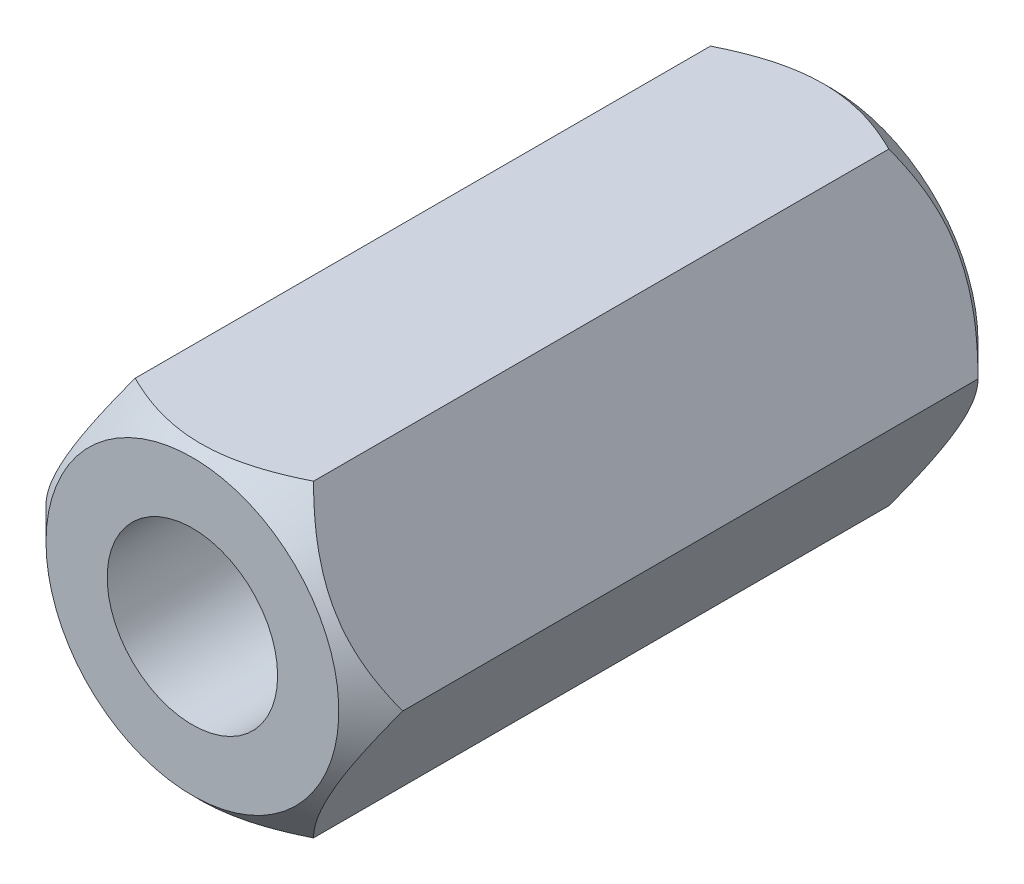
from build123d import *

# Parameters (mm, degrees)
EXTRUDE_1_DEPTH   = 3
HOLE_WIZARD_M21_D = 1.6


with BuildPart() as part:
    # Эскиз1 → Бобышка-Вытянуть1 (new, symmetric)
    with BuildSketch(Plane.XY):
        Polygon((1.674315781, 0), (0.83715789, 1.45), (-0.83715789, 1.45), (-1.674315781, 0), (-0.83715789, -1.45), (0.83715789, -1.45), align=None)
    extrude(amount=EXTRUDE_1_DEPTH, both=True)

    # Отверстие обработанное метчиком M21 (through all)
    with Locations(Plane.XY.offset(3)):
        with Locations((0, 0)):
            Hole(HOLE_WIZARD_M21_D / 2)

    # Эскиз4 → Вырез-Повернуть1 (revolve, cut)
    with BuildSketch(Plane(origin=(0, 0, 0), x_dir=(0, 0, -1), z_dir=(0, 1, 0))):
        Polygon((3, 1.374315781), (2.7, 1.674315781), (3, 1.674315781), align=None)
        Polygon((-3, 1.674315781), (-3, 1.374315781), (-2.7, 1.674315781), align=None)
    revolve(axis=Axis((0, 0, -3), (0, 0, 1)), mode=Mode.SUBTRACT)


solid = part.part
